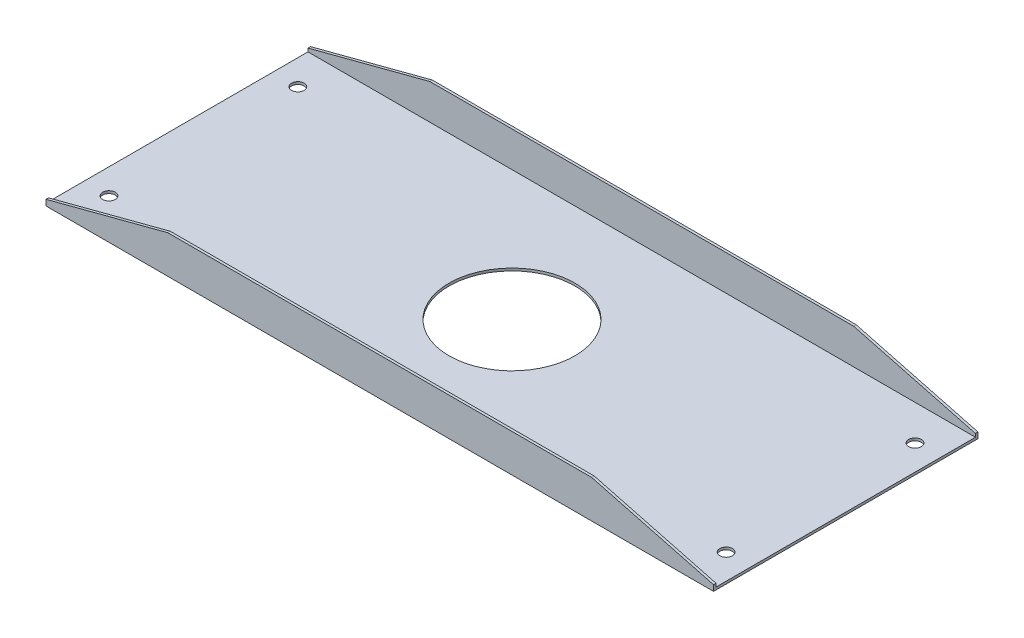
from build123d import *

# Parameters (mm, degrees)
EXTRUDE_1_DEPTH     = 530
SKETCH_2_OUTSIDE_W  = 646.176
SKETCH_2_OUTSIDE_H  = 146.176
CUT_EXTRUDE_2_DEPTH = 571.876519048
SKETCH_3_R          = 5
SKETCH_3_R_2        = 50
CUT_EXTRUDE_3_DEPTH = 542.025877385


with BuildPart() as part:
    # Эскиз1 → Вытянуть-Тонкостенный1 (new body)
    with BuildSketch(Plane(origin=(0, 0, 0), x_dir=(0, 0, -1), z_dir=(1, 0, 0))):
        Polygon((-105, 30), (-105, 0), (105, 0), (105, 30), (103, 30), (103, 2), (-103, 2), (-103, 30), align=None)
    extrude(amount=EXTRUDE_1_DEPTH)

    # Эскиз2 outside → Вырез-Вытянуть2 (cut, through all)
    with BuildSketch(Plane(origin=(0, 0, -105), x_dir=(-1, 0, 0), z_dir=(0, 0, -1))):
        with Locations((-265, 15)):
            Rectangle(SKETCH_2_OUTSIDE_W, SKETCH_2_OUTSIDE_H)
        Polygon((-530, 0), (-530, 4.614828056), (-433.275685346, 30), (-96.724314654, 30), (0, 4.614828056), (0, 0), align=None, mode=Mode.SUBTRACT)
    extrude(amount=-CUT_EXTRUDE_2_DEPTH, mode=Mode.SUBTRACT)

    # Эскиз3 → Вырез-Вытянуть3 (cut, through all)
    with BuildSketch(Plane(origin=(0, 2, 0), x_dir=(1, 0, 0), z_dir=(0, 1, 0))):
        with Locations((20, 75)):
            Circle(SKETCH_3_R)
        with Locations((20, -75)):
            Circle(SKETCH_3_R)
        with Locations((510, 75)):
            Circle(SKETCH_3_R)
        with Locations((510, -75)):
            Circle(SKETCH_3_R)
        with Locations((265, 0)):
            Circle(SKETCH_3_R_2)
    extrude(amount=-CUT_EXTRUDE_3_DEPTH, mode=Mode.SUBTRACT)


solid = part.part
